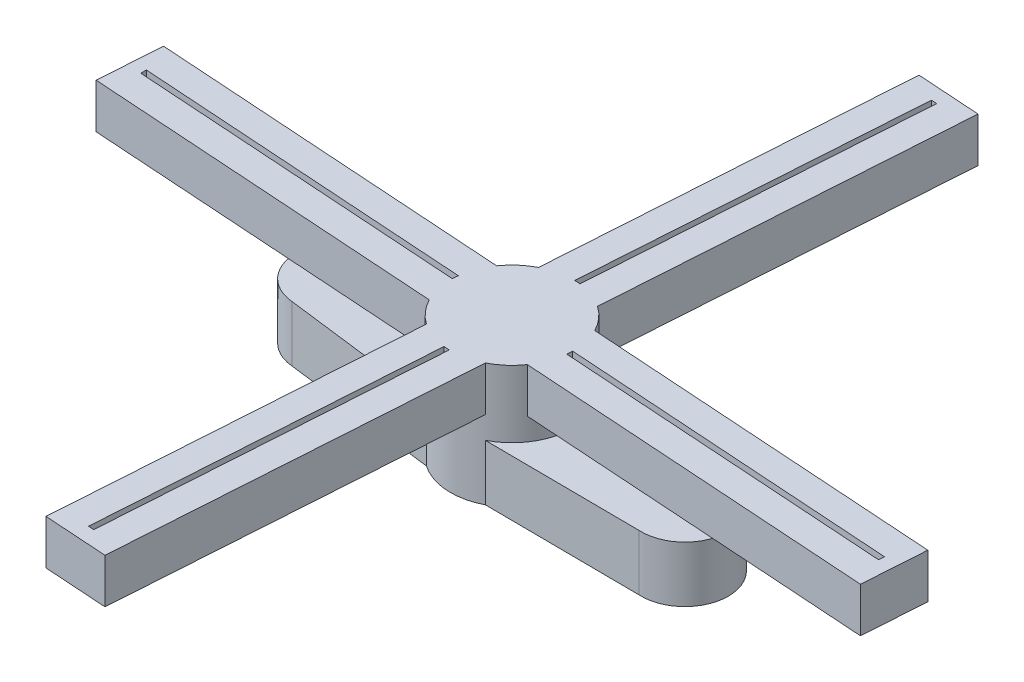
from build123d import *

# Parameters (mm, degrees)
EXTRUDE_1_DEPTH = 3
SKETCH_2_R      = 0.6
SKETCH_2_R_2    = 1.25
EXTRUDE_2_DEPTH = 2
SKETCH_3_R      = 5.5
EXTRUDE_3_DEPTH = 2
SKETCH_4_R      = 5.5
EXTRUDE_5_DEPTH = 4


# Read off the part's stored shape, not the designer's step: 填料-伸長1
with BuildPart() as part:
    # 填料-伸長1 outline → 填料-伸長1 (new body)
    with BuildSketch(Plane(origin=(0, 14.156954032, 0), x_dir=(1, 0, 0), z_dir=(0, 1, 0))):
        with BuildLine():
            Line((-82.339013046, -221.365982672), (-68.587342058, -223.095847576))
            ThreePointArc((-68.587342058, -223.095847576), (-65.812443105, -224.067756352), (-62.933383432, -223.471361963))
            Line((-62.933383432, -223.471361963), (-49.073726982, -223.575336213))
            ThreePointArc((-49.073726982, -223.575336213), (-44.993021918, -219.938385769), (-48.556901099, -215.793711169))
            Line((-48.556901099, -215.793711169), (-62.308572088, -214.063846266))
            ThreePointArc((-62.308572088, -214.063846266), (-65.08347104, -213.091937489), (-67.962530713, -213.688331878))
            Line((-67.962530713, -213.688331878), (-81.822187163, -213.584357628))
            ThreePointArc((-81.822187163, -213.584357628), (-85.902892228, -217.221308072), (-82.339013046, -221.365982672))
        make_face()
        with BuildLine():
            Line((-49.024567087, -221.975659985), (-63.351091856, -221.868183318))
            ThreePointArc((-63.351091856, -221.868183318), (-65.706410804, -222.471273609), (-67.96128377, -221.561991939))
            Line((-67.96128377, -221.561991939), (-82.176185543, -219.773855813))
            ThreePointArc((-82.176185543, -219.773855813), (-84.306409484, -217.327340372), (-81.871347058, -215.184033856))
            Line((-81.871347058, -215.184033856), (-67.544822289, -215.291510523))
            ThreePointArc((-67.544822289, -215.291510523), (-65.189503341, -214.688420233), (-62.934630375, -215.597701902))
            Line((-62.934630375, -215.597701902), (-48.719728602, -217.385838028))
            ThreePointArc((-48.719728602, -217.385838028), (-46.589504661, -219.832353469), (-49.024567087, -221.975659985))
        make_face(mode=Mode.SUBTRACT)
    extrude(amount=EXTRUDE_1_DEPTH)

    # 草圖2 → 填料-伸長2 (add)
    with BuildSketch(Plane(origin=(0, 17.156954032, 0), x_dir=(1, 0, 0), z_dir=(0, 1, 0))):
        with BuildLine():
            Line((-82.339013046, -221.365982672), (-68.587342058, -223.095847576))
            ThreePointArc((-68.587342058, -223.095847576), (-65.812443105, -224.067756352), (-62.933383432, -223.471361963))
            Line((-62.933383432, -223.471361963), (-49.073726982, -223.575336213))
            ThreePointArc((-49.073726982, -223.575336213), (-44.993021918, -219.938385769), (-48.556901099, -215.793711169))
            Line((-48.556901099, -215.793711169), (-62.308572088, -214.063846266))
            ThreePointArc((-62.308572088, -214.063846266), (-65.08347104, -213.091937489), (-67.962530713, -213.688331878))
            Line((-67.962530713, -213.688331878), (-81.822187163, -213.584357628))
            ThreePointArc((-81.822187163, -213.584357628), (-85.902892228, -217.221308072), (-82.339013046, -221.365982672))
        make_face()
        with Locations(Location((-48.185987405, -219.726321168, 0), (0, 0, 270))):
            Circle(SKETCH_2_R, mode=Mode.SUBTRACT)
        with Locations(Location((-50.281371006, -219.587153774, 0), (0, 0, 270))):
            Circle(SKETCH_2_R, mode=Mode.SUBTRACT)
        with Locations(Location((-52.376754608, -219.44798638, 0), (0, 0, 270))):
            Circle(SKETCH_2_R, mode=Mode.SUBTRACT)
        with Locations(Location((-54.472138209, -219.308818985, 0), (0, 0, 270))):
            Circle(SKETCH_2_R, mode=Mode.SUBTRACT)
        with Locations(Location((-56.56752181, -219.169651591, 0), (0, 0, 270))):
            Circle(SKETCH_2_R, mode=Mode.SUBTRACT)
        with Locations(Location((-58.662905411, -219.030484197, 0), (0, 0, 270))):
            Circle(SKETCH_2_R, mode=Mode.SUBTRACT)
        with Locations(Location((-65.447957073, -218.579846921, 0), (0, 0, 270))):
            Circle(SKETCH_2_R_2, mode=Mode.SUBTRACT)
        with Locations(Location((-72.233008734, -218.129209644, 0), (0, 0, 270))):
            Circle(SKETCH_2_R, mode=Mode.SUBTRACT)
        with Locations(Location((-74.328392335, -217.99004225, 0), (0, 0, 270))):
            Circle(SKETCH_2_R, mode=Mode.SUBTRACT)
        with Locations(Location((-76.423775936, -217.850874856, 0), (0, 0, 270))):
            Circle(SKETCH_2_R, mode=Mode.SUBTRACT)
        with Locations(Location((-78.519159538, -217.711707461, 0), (0, 0, 270))):
            Circle(SKETCH_2_R, mode=Mode.SUBTRACT)
        with Locations(Location((-80.614543139, -217.572540067, 0), (0, 0, 270))):
            Circle(SKETCH_2_R, mode=Mode.SUBTRACT)
        with Locations(Location((-82.70992674, -217.433372673, 0), (0, 0, 270))):
            Circle(SKETCH_2_R, mode=Mode.SUBTRACT)
    extrude(amount=EXTRUDE_2_DEPTH)

    # 草圖3 → 填料-伸長3 (add)
    with BuildSketch(Plane(origin=(0, 19.156954032, 0), x_dir=(1, 0, 0), z_dir=(0, 1, 0))):
        with Locations(Location((-65.447957073, -218.579846921, 0), (0, 0, 117.206266925))):
            Circle(SKETCH_3_R)
    extrude(amount=EXTRUDE_3_DEPTH)

    # 草圖4 → 填料-伸長5 (add)
    with BuildSketch(Plane(origin=(0, 21.156954032, 0), x_dir=(1, 0, 0), z_dir=(0, 1, 0))):
        with BuildLine():
            Line((-65.841884706, -181.758677002), (-67.962530713, -213.688331878))
            ThreePointArc((-67.962530713, -213.688331878), (-66.686272082, -213.221061989), (-65.334397341, -213.081019392))
            Line((-65.334397341, -213.081019392), (-63.345192567, -183.146990755))
            Line((-63.345192567, -183.146990755), (-62.84629171, -183.180125849))
            Line((-62.84629171, -183.180125849), (-64.834397341, -213.114177295))
            ThreePointArc((-64.834397341, -213.114177295), (-63.512339264, -213.431703207), (-62.308572088, -214.063846266))
            Line((-62.308572088, -214.063846266), (-60.187926081, -182.134191389))
            Line((-60.187926081, -182.134191389), (-65.841884706, -181.758677002))
        make_face()
        with BuildLine():
            Line((-28.626787154, -218.185919287), (-60.55644203, -216.06527328))
            ThreePointArc((-60.55644203, -216.06527328), (-60.102242306, -217.286272944), (-59.947957073, -218.579846921))
            ThreePointArc((-59.947957073, -218.579846921), (-59.94806161, -218.613757162), (-59.94837522, -218.647666115))
            Line((-59.94837522, -218.647666115), (-30.05766404, -220.633992316))
            Line((-30.05766404, -220.633992316), (-30.090799133, -221.132893173))
            Line((-30.090799133, -221.132893173), (-59.977374886, -219.147940697))
            ThreePointArc((-59.977374886, -219.147940697), (-60.291810853, -220.494045491), (-60.931956418, -221.719231906))
            Line((-60.931956418, -221.719231906), (-29.002301541, -223.839877913))
            Line((-29.002301541, -223.839877913), (-28.626787154, -218.185919287))
        make_face()
        with Locations(Location((-65.447957073, -218.579846921, 0), (0, 0, 117.206266925))):
            Circle(SKETCH_4_R)
        with BuildLine():
            ThreePointArc((-66.061516804, -224.045516546), (-67.383574881, -223.727990635), (-68.587342058, -223.095847576))
            Line((-68.587342058, -223.095847576), (-70.707988065, -255.025502452))
            Line((-70.707988065, -255.025502452), (-65.054029439, -255.401016839))
            Line((-65.054029439, -255.401016839), (-62.933383432, -223.471361963))
            ThreePointArc((-62.933383432, -223.471361963), (-64.209643695, -223.938632229), (-65.561520152, -224.07867438))
            Line((-65.561520152, -224.07867438), (-67.544665601, -253.921520844))
            Line((-67.544665601, -253.921520844), (-68.043566458, -253.88838575))
            Line((-68.043566458, -253.88838575), (-66.061516804, -224.045516546))
        make_face()
        with BuildLine():
            ThreePointArc((-70.908334203, -217.920846468), (-70.588006225, -216.622835241), (-69.963957728, -215.440461936))
            Line((-69.963957728, -215.440461936), (-101.893612604, -213.319815929))
            Line((-101.893612604, -213.319815929), (-102.269126991, -218.973774554))
            Line((-102.269126991, -218.973774554), (-70.339472115, -221.094420561))
            ThreePointArc((-70.339472115, -221.094420561), (-70.811844008, -219.795871979), (-70.945650262, -218.420568553))
            Line((-70.945650262, -218.420568553), (-100.832194129, -216.434519282))
            Line((-100.832194129, -216.434519282), (-100.799059035, -215.935618425))
            Line((-100.799059035, -215.935618425), (-70.908334203, -217.920846468))
        make_face()
    extrude(amount=EXTRUDE_5_DEPTH)


solid = part.part
